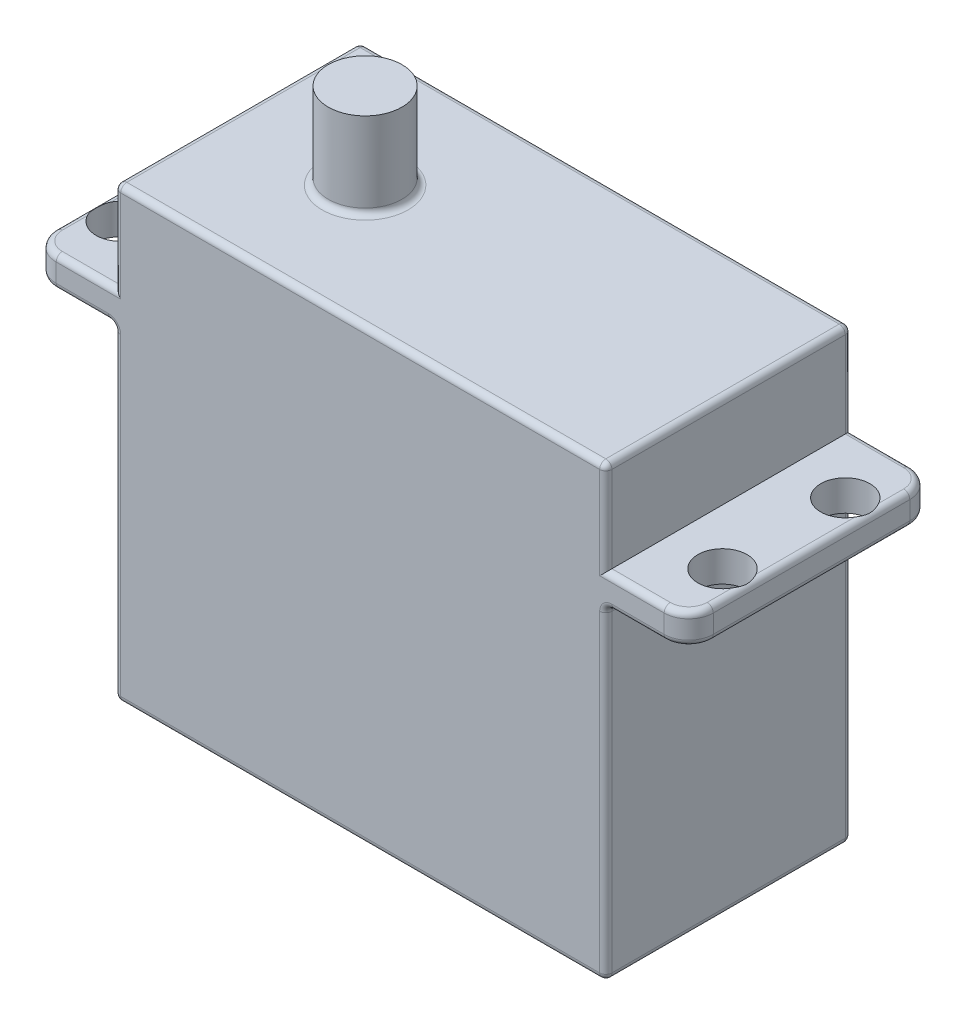
from build123d import *

# Parameters (mm, degrees)
SKETCH_1_W      = 40
SKETCH_1_H      = 20
EXTRUDE_1_DEPTH = 36.5
SKETCH_2_R      = 2.0000000000000027
SKETCH_2_R_2    = 2.000000000000003
SKETCH_2_R_3    = 2.0000000000000036
EXTRUDE_2_DEPTH = 2.5
SKETCH_3_R      = 3.0000000000000013
EXTRUDE_3_DEPTH = 7.000000000000004
FILLET_5_R      = 0.5


with BuildPart() as part:
    # Эскиз1 → Бобышка-Вытянуть1 (new body)
    with BuildSketch(Plane(origin=(0, 0, 0), x_dir=(1, 0, 0), z_dir=(0, 1, 0))):
        with Locations((20, 10)):
            Rectangle(SKETCH_1_W, SKETCH_1_H)
    extrude(amount=EXTRUDE_1_DEPTH)

    # Эскиз2 → Бобышка-Вытянуть2 (add)
    with BuildSketch(Plane(origin=(0, 26.5, 0), x_dir=(-1, 0, 0), z_dir=(0, -1, 0))):
        with BuildLine():
            Line((-44.749999999999986, 20), (4.749999999999984, 20.00000000000001))
            ThreePointArc((4.749999999999984, 20.00000000000001), (6.164213562373094, 19.414213562373106), (6.749999999999999, 17.999999999999996))
            Line((6.749999999999999, 17.999999999999996), (6.749999999999999, 4.031754163448127))
            Line((6.749999999999999, 4.031754163448127), (6.749999999999999, 2.000000000000014))
            ThreePointArc((6.749999999999999, 2.000000000000014), (6.164213562373094, 0.5857864376269049), (4.749999999999985, 0))
            Line((4.749999999999985, 0), (-44.749999999999986, 0))
            ThreePointArc((-44.749999999999986, 0), (-46.16421356237309, 0.5857864376269046), (-46.75, 2.000000000000014))
            Line((-46.75, 2.000000000000014), (-46.75, 17.99999999999999))
            ThreePointArc((-46.75, 17.99999999999999), (-46.16421356237309, 19.4142135623731), (-44.749999999999986, 20))
        make_face()
        with Locations(Location((-44.5, 15, 0), (0, 0, 90))):
            Circle(SKETCH_2_R, mode=Mode.SUBTRACT)
        with Locations(Location((-44.5, 4.999999999999998, 0), (0, 0, 90))):
            Circle(SKETCH_2_R_2, mode=Mode.SUBTRACT)
        with Locations(Location((4.500000000000001, 15, 0), (0, 0, 90))):
            Circle(SKETCH_2_R_3, mode=Mode.SUBTRACT)
        with Locations(Location((4.499999999999997, 4.999999999999998, 0), (0, 0, 90))):
            Circle(SKETCH_2_R_2, mode=Mode.SUBTRACT)
    extrude(amount=-EXTRUDE_2_DEPTH)

    # Эскиз3 → Бобышка-Вытянуть3 (add)
    with BuildSketch(Plane(origin=(0, 36.5, 0), x_dir=(1, 0, 0), z_dir=(0, 1, 0))):
        with Locations(Location((10.4, 10, 0), (0, 0, 90))):
            Circle(SKETCH_3_R)
    extrude(amount=EXTRUDE_3_DEPTH)

    # Скругление5
    # the kernel refuses this fillet: 0.5 mm, written as the material it adds along each edge
    with BuildSketch(Plane(origin=(0, 26.5, -20), x_dir=(0, -1, 0), z_dir=(0, 0, 1))) as fillet_5_piece_1:
        with BuildLine():
            CenterArc((FILLET_5_R, -FILLET_5_R), FILLET_5_R, 90, 90)
            Line((0, -FILLET_5_R), (0, 0))
            Line((0, 0), (FILLET_5_R, 0))
        make_face()
    extrude(amount=20)
    with BuildSketch(Plane(origin=(40, 26.5, 0), x_dir=(1, 0, 0), z_dir=(0, 0, -1))) as fillet_5_piece_2:
        with BuildLine():
            CenterArc((FILLET_5_R, FILLET_5_R), FILLET_5_R, 180, 90)
            Line((0, FILLET_5_R), (0, 0))
            Line((0, 0), (FILLET_5_R, 0))
        make_face()
    extrude(amount=20)
    with BuildSketch(Plane(origin=(10.4, 36.5, -10), x_dir=(0, 0, -1), z_dir=(1, 0, 0))) as fillet_5_piece_3:
        with BuildLine():
            CenterArc((3.0000000000000018 + FILLET_5_R, FILLET_5_R), FILLET_5_R, 180, 90)
            Line((3.0000000000000018, FILLET_5_R), (3.0000000000000018, 0))
            Line((3.0000000000000018, 0), (3.0000000000000018 + FILLET_5_R, 0))
        make_face()
    revolve(axis=Axis((10.4, 36.5, -10), (0, 1, 0)))
    # the kernel refuses this fillet: 0.5 mm, written as the material it takes off along each edge
    with BuildSketch(Plane(origin=(39.5, 36, -0.5), x_dir=(0, 0, 1), z_dir=(1, 0, 0))) as fillet_5_2_piece_1_section:
        Polygon((0, 0), (FILLET_5_R, 0), (FILLET_5_R, -FILLET_5_R), (0, -FILLET_5_R), align=None)
    fillet_5_2_piece_1 = extrude(amount=FILLET_5_R, mode=Mode.PRIVATE)
    fillet_5_2_piece_1 = fillet_5_2_piece_1 - Plane(origin=(39.5, 36, -0.5), x_dir=(0, -0.7071067811865475, -0.7071067811865475), z_dir=(1, 0, 0)) * Sphere(FILLET_5_R, mode=Mode.PRIVATE)
    add(fillet_5_2_piece_1, mode=Mode.SUBTRACT)
    with BuildSketch(Plane(origin=(39.5, 36, -19.5), x_dir=(0, 0, -1), z_dir=(1, 0, 0))) as fillet_5_2_piece_2_section:
        Polygon((0, 0), (FILLET_5_R, 0), (FILLET_5_R, FILLET_5_R), (0, FILLET_5_R), align=None)
    fillet_5_2_piece_2 = extrude(amount=FILLET_5_R, mode=Mode.PRIVATE)
    fillet_5_2_piece_2 = fillet_5_2_piece_2 - Plane(origin=(39.5, 36, -19.5), x_dir=(0, -0.7071067811865475, 0.7071067811865475), z_dir=(1, 0, 0)) * Sphere(FILLET_5_R, mode=Mode.PRIVATE)
    add(fillet_5_2_piece_2, mode=Mode.SUBTRACT)
    with BuildSketch(Plane(origin=(0.5, 36, -19.5), x_dir=(-1, 0, 0), z_dir=(0, 0, -1))) as fillet_5_2_piece_3_section:
        Polygon((0, 0), (FILLET_5_R, 0), (FILLET_5_R, FILLET_5_R), (0, FILLET_5_R), align=None)
    fillet_5_2_piece_3 = extrude(amount=FILLET_5_R, mode=Mode.PRIVATE)
    fillet_5_2_piece_3 = fillet_5_2_piece_3 - Plane(origin=(0.5, 36, -19.5), x_dir=(0.7071067811865475, -0.7071067811865475, 0), z_dir=(0, 0, -1)) * Sphere(FILLET_5_R, mode=Mode.PRIVATE)
    add(fillet_5_2_piece_3, mode=Mode.SUBTRACT)
    with BuildSketch(Plane(origin=(0.5, 36, -0.5), x_dir=(-1, 0, 0), z_dir=(0, 0, 1))) as fillet_5_2_piece_4_section:
        Polygon((0, 0), (FILLET_5_R, 0), (FILLET_5_R, -FILLET_5_R), (0, -FILLET_5_R), align=None)
    fillet_5_2_piece_4 = extrude(amount=FILLET_5_R, mode=Mode.PRIVATE)
    fillet_5_2_piece_4 = fillet_5_2_piece_4 - Plane(origin=(0.5, 36, -0.5), x_dir=(0.7071067811865475, -0.7071067811865475, 0), z_dir=(0, 0, 1)) * Sphere(FILLET_5_R, mode=Mode.PRIVATE)
    add(fillet_5_2_piece_4, mode=Mode.SUBTRACT)
    with BuildSketch(Plane(origin=(40, 36.5, -0.5), x_dir=(-1, 0, 0), z_dir=(0, 0, -1))) as fillet_5_2_piece_5:
        with BuildLine():
            CenterArc((FILLET_5_R, -FILLET_5_R), FILLET_5_R, 90, 90)
            Line((0, -FILLET_5_R), (0, 0))
            Line((0, 0), (FILLET_5_R, 0))
        make_face()
    extrude(amount=19, mode=Mode.SUBTRACT)
    with BuildSketch(Plane(origin=(39.5, 36.5, -20), x_dir=(0, 0, 1), z_dir=(-1, 0, 0))) as fillet_5_2_piece_6:
        with BuildLine():
            CenterArc((FILLET_5_R, -FILLET_5_R), FILLET_5_R, 90, 90)
            Line((0, -FILLET_5_R), (0, 0))
            Line((0, 0), (FILLET_5_R, 0))
        make_face()
    extrude(amount=39, mode=Mode.SUBTRACT)
    with BuildSketch(Plane(origin=(-4.749999999999985, 29, 0), x_dir=(0, -1, 0), z_dir=(1, 0, 0))) as fillet_5_2_piece_7:
        with BuildLine():
            CenterArc((FILLET_5_R, FILLET_5_R), FILLET_5_R, 180, 90)
            Line((0, FILLET_5_R), (0, 0))
            Line((0, 0), (FILLET_5_R, 0))
        make_face()
    extrude(amount=4.749999999999985, mode=Mode.SUBTRACT)
    with BuildSketch(Plane(origin=(40, 29, 0), x_dir=(0, -1, 0), z_dir=(1, 0, 0))) as fillet_5_2_piece_8:
        with BuildLine():
            CenterArc((FILLET_5_R, FILLET_5_R), FILLET_5_R, 180, 90)
            Line((0, FILLET_5_R), (0, 0))
            Line((0, 0), (FILLET_5_R, 0))
        make_face()
    extrude(amount=4.749999999999986, mode=Mode.SUBTRACT)
    with BuildSketch(Plane(origin=(0, 29, -20.00000000000001), x_dir=(-2.2e-16, 0, 1), z_dir=(-1, 0, -2.2e-16)), Plane(origin=(44.749999999999986, 29, -20), x_dir=(-2.2e-16, 0, 1), z_dir=(-1, 0, -2.2e-16))) as fillet_5_2_piece_9:
        with BuildLine():
            CenterArc((FILLET_5_R, -FILLET_5_R), FILLET_5_R, 90, 90)
            Line((0, -FILLET_5_R), (0, 0))
            Line((0, 0), (FILLET_5_R, 0))
        make_face()
    extrude(amount=4.749999999999986, mode=Mode.SUBTRACT)
    with BuildSketch(Plane(origin=(-4.749999999999998, 29, -2.0000000000000004), x_dir=(-1, 0, -6.88e-15), z_dir=(6.88e-15, 0, -1))) as fillet_5_2_piece_10:
        with BuildLine():
            CenterArc((2 - FILLET_5_R, -FILLET_5_R), FILLET_5_R, 0, 89.9999999999998)
            Line((2 - FILLET_5_R, 0), (2, 0))
            Line((2, 0), (2, -FILLET_5_R))
        make_face()
    revolve(axis=Axis((-4.749999999999998, 29, -2.0000000000000004), (0, 1, 0)), revolution_arc=90.00000000000078, mode=Mode.SUBTRACT)
    with BuildSketch(Plane(origin=(44.74999999999999, 29, -2.000000000000005), x_dir=(-3.55e-15, 0, 1), z_dir=(-1, 0, -3.55e-15))) as fillet_5_2_piece_11:
        with BuildLine():
            CenterArc((2.000000000000006 - FILLET_5_R, -FILLET_5_R), FILLET_5_R, 0, 90)
            Line((2.0000000000000067, -FILLET_5_R), (2.000000000000006, 0))
            Line((2.000000000000006, 0), (2.000000000000006 - FILLET_5_R, 0))
        make_face()
    revolve(axis=Axis((44.74999999999999, 29, -2.000000000000005), (0, 1, 0)), revolution_arc=90.00000000000047, mode=Mode.SUBTRACT)
    with BuildSketch(Plane(origin=(46.75, 29, -2.000000000000014), x_dir=(-1, 0, 0), z_dir=(0, 0, -1))) as fillet_5_2_piece_12:
        with BuildLine():
            CenterArc((FILLET_5_R, -FILLET_5_R), FILLET_5_R, 90, 90)
            Line((0, -FILLET_5_R), (0, 0))
            Line((0, 0), (FILLET_5_R, 0))
        make_face()
    extrude(amount=15.999999999999975, mode=Mode.SUBTRACT)
    with BuildSketch(Plane(origin=(44.75, 29, -18.000000000000004), x_dir=(1, 0, 7.11e-15), z_dir=(-7.11e-15, 0, 1))) as fillet_5_2_piece_13:
        with BuildLine():
            CenterArc((2 - FILLET_5_R, -FILLET_5_R), FILLET_5_R, 0, 90)
            Line((2, -FILLET_5_R), (2, 0))
            Line((2, 0), (2 - FILLET_5_R, 0))
        make_face()
    revolve(axis=Axis((44.75, 29, -18.000000000000004), (0, 1, 0)), revolution_arc=90.00000000000081, mode=Mode.SUBTRACT)
    with BuildSketch(Plane(origin=(-4.75, 29, -18.000000000000014), x_dir=(7.99e-15, 0, -1), z_dir=(1, 0, 7.99e-15))) as fillet_5_2_piece_14:
        with BuildLine():
            CenterArc((1.9999999999999964 - FILLET_5_R, -FILLET_5_R), FILLET_5_R, 0, 90)
            Line((1.9999999999999964, -FILLET_5_R), (1.9999999999999964, 0))
            Line((1.9999999999999964, 0), (1.9999999999999964 - FILLET_5_R, 0))
        make_face()
    revolve(axis=Axis((-4.75, 29, -18.000000000000014), (0, 1, 0)), revolution_arc=90.00000000000097, mode=Mode.SUBTRACT)
    with BuildSketch(Plane(origin=(-6.749999999999998, 29, -2.000000000000014), x_dir=(1, 0, 0), z_dir=(0, 0, -1))) as fillet_5_2_piece_15:
        with BuildLine():
            CenterArc((FILLET_5_R, FILLET_5_R), FILLET_5_R, 180, 90)
            Line((-1.78e-15, FILLET_5_R), (0, 0))
            Line((0, 0), (FILLET_5_R, 0))
        make_face()
    extrude(amount=15.999999999999982, mode=Mode.SUBTRACT)
    with BuildSketch(Plane(origin=(0, 36.5, -19.5), x_dir=(0, -1, 0), z_dir=(0, 0, 1))) as fillet_5_2_piece_16:
        with BuildLine():
            CenterArc((FILLET_5_R, FILLET_5_R), FILLET_5_R, 180, 90)
            Line((0, FILLET_5_R), (0, 0))
            Line((0, 0), (FILLET_5_R, 0))
        make_face()
    extrude(amount=19, mode=Mode.SUBTRACT)
    with BuildSketch(Plane(origin=(41.25, 0, -20), x_dir=(0, 0, 1), z_dir=(-1, 0, 0))) as fillet_5_2_piece_17:
        with BuildLine():
            CenterArc((FILLET_5_R, FILLET_5_R), FILLET_5_R, 180, 90)
            Line((0, FILLET_5_R), (0, 0))
            Line((0, 0), (FILLET_5_R, 0))
        make_face()
    extrude(amount=42.5, mode=Mode.SUBTRACT)
    with BuildSketch(Plane(origin=(40, 0, 1.25), x_dir=(-1, 0, 0), z_dir=(0, 0, -1))) as fillet_5_2_piece_18:
        with BuildLine():
            CenterArc((FILLET_5_R, FILLET_5_R), FILLET_5_R, 180, 90)
            Line((0, FILLET_5_R), (0, 0))
            Line((0, 0), (FILLET_5_R, 0))
        make_face()
    extrude(amount=22.5, mode=Mode.SUBTRACT)
    with BuildSketch(Plane(origin=(-1.25, 0, 0), x_dir=(0, 1, 0), z_dir=(1, 0, 0))) as fillet_5_2_piece_19:
        with BuildLine():
            CenterArc((FILLET_5_R, -FILLET_5_R), FILLET_5_R, 90, 90)
            Line((-6e-17, -FILLET_5_R), (0, 0))
            Line((0, 0), (FILLET_5_R, 0))
        make_face()
    extrude(amount=42.5, mode=Mode.SUBTRACT)
    with BuildSketch(Plane(origin=(0, 0, -21.25), x_dir=(1, 0, 0), z_dir=(0, 0, 1))) as fillet_5_2_piece_20:
        with BuildLine():
            CenterArc((FILLET_5_R, FILLET_5_R), FILLET_5_R, 180, 90)
            Line((0, FILLET_5_R), (0, 0))
            Line((0, 0), (FILLET_5_R, 0))
        make_face()
    extrude(amount=22.5, mode=Mode.SUBTRACT)
    with BuildSketch(Plane(origin=(0, 29, -20), x_dir=(0, 0, 1), z_dir=(0, 1, 0))) as fillet_5_2_piece_21:
        with BuildLine():
            CenterArc((FILLET_5_R, FILLET_5_R), FILLET_5_R, 180, 90)
            Line((0, FILLET_5_R), (0, 0))
            Line((0, 0), (FILLET_5_R, 0))
        make_face()
    extrude(amount=7, mode=Mode.SUBTRACT)
    with BuildSketch(Plane(origin=(40, 29, -20), x_dir=(0, 0, 1), z_dir=(0, 1, 0))) as fillet_5_2_piece_22:
        with BuildLine():
            CenterArc((FILLET_5_R, -FILLET_5_R), FILLET_5_R, 90, 90)
            Line((0, -FILLET_5_R), (0, 0))
            Line((0, 0), (FILLET_5_R, 0))
        make_face()
    extrude(amount=7, mode=Mode.SUBTRACT)
    with BuildSketch(Plane(origin=(40, 29, 0), x_dir=(-1, 0, 0), z_dir=(0, 1, 0))) as fillet_5_2_piece_23:
        with BuildLine():
            CenterArc((FILLET_5_R, -FILLET_5_R), FILLET_5_R, 90, 90)
            Line((0, -FILLET_5_R), (0, 0))
            Line((0, 0), (FILLET_5_R, 0))
        make_face()
    extrude(amount=7, mode=Mode.SUBTRACT)
    with BuildSketch(Plane(origin=(0, 29, 0), x_dir=(1, 0, 0), z_dir=(0, 1, 0))) as fillet_5_2_piece_24:
        with BuildLine():
            CenterArc((FILLET_5_R, FILLET_5_R), FILLET_5_R, 180, 90)
            Line((-6e-17, FILLET_5_R), (0, 0))
            Line((0, 0), (FILLET_5_R, 0))
        make_face()
    extrude(amount=7, mode=Mode.SUBTRACT)
    with BuildSketch(Plane(origin=(0.5, 36.5, 0), x_dir=(0, -1, 0), z_dir=(1, 0, 0))) as fillet_5_2_piece_25:
        with BuildLine():
            CenterArc((FILLET_5_R, FILLET_5_R), FILLET_5_R, 180, 90)
            Line((0, FILLET_5_R), (0, 0))
            Line((0, 0), (FILLET_5_R, 0))
        make_face()
    extrude(amount=39, mode=Mode.SUBTRACT)
    with BuildSketch(Plane(origin=(-4.749999999999985, 29, 0), x_dir=(0, -1, 0), z_dir=(1, 0, 0))) as fillet_5_2_piece_26a_section:
        with BuildLine():
            CenterArc((FILLET_5_R, FILLET_5_R), FILLET_5_R, 180, 90)
            Line((0, FILLET_5_R), (0, 0))
            Line((0, 0), (FILLET_5_R, 0))
        make_face()
    fillet_5_2_piece_26a = extrude(amount=5.999999999999985, mode=Mode.PRIVATE)
    fillet_5_2_piece_26a = split(fillet_5_2_piece_26a, bisect_by=Plane(origin=(0, 28.88680244286659, -0.1131975571334145), z_dir=(1, 0, 0)), keep=Keep.TOP, mode=Mode.PRIVATE)
    with BuildSketch(Plane(origin=(0, 27.75, 0), x_dir=(1, 0, 0), z_dir=(0, 1, 0))) as fillet_5_2_piece_26b_section:
        with BuildLine():
            CenterArc((FILLET_5_R, FILLET_5_R), FILLET_5_R, 180, 90)
            Line((-6e-17, FILLET_5_R), (0, 0))
            Line((0, 0), (FILLET_5_R, 0))
        make_face()
    fillet_5_2_piece_26b = extrude(amount=8.25, mode=Mode.PRIVATE)
    fillet_5_2_piece_26b = split(fillet_5_2_piece_26b, bisect_by=Plane(origin=(0.11319755713341095, 29, -0.11319755713341273), z_dir=(0, -1, 0)), keep=Keep.TOP, mode=Mode.PRIVATE)
    fillet_5_2_piece_26 = fillet_5_2_piece_26a & fillet_5_2_piece_26b
    add(fillet_5_2_piece_26, mode=Mode.SUBTRACT)
    with BuildSketch(Plane(origin=(40, 27.75, 0), x_dir=(-1, 0, 0), z_dir=(0, 1, 0))) as fillet_5_2_piece_27a_section:
        with BuildLine():
            CenterArc((FILLET_5_R, -FILLET_5_R), FILLET_5_R, 90, 90)
            Line((0, -FILLET_5_R), (0, 0))
            Line((0, 0), (FILLET_5_R, 0))
        make_face()
    fillet_5_2_piece_27a = extrude(amount=8.25, mode=Mode.PRIVATE)
    fillet_5_2_piece_27a = split(fillet_5_2_piece_27a, bisect_by=Plane(origin=(39.886802442866596, 29, -0.11319755713341095), z_dir=(0, -1, 0)), keep=Keep.TOP, mode=Mode.PRIVATE)
    with BuildSketch(Plane(origin=(38.75, 29, 0), x_dir=(0, -1, 0), z_dir=(1, 0, 0))) as fillet_5_2_piece_27b_section:
        with BuildLine():
            CenterArc((FILLET_5_R, FILLET_5_R), FILLET_5_R, 180, 90)
            Line((0, FILLET_5_R), (0, 0))
            Line((0, 0), (FILLET_5_R, 0))
        make_face()
    fillet_5_2_piece_27b = extrude(amount=5.999999999999986, mode=Mode.PRIVATE)
    fillet_5_2_piece_27b = split(fillet_5_2_piece_27b, bisect_by=Plane(origin=(40, 28.886802442866593, -0.11319755713341453), z_dir=(-1, 0, 0)), keep=Keep.TOP, mode=Mode.PRIVATE)
    fillet_5_2_piece_27 = fillet_5_2_piece_27a & fillet_5_2_piece_27b
    add(fillet_5_2_piece_27, mode=Mode.SUBTRACT)
    with BuildSketch(Plane(origin=(1.25, 29, -20), x_dir=(-2.2e-16, 0, 1), z_dir=(-1, 0, -2.2e-16))) as fillet_5_2_piece_28a_section:
        with BuildLine():
            CenterArc((FILLET_5_R, -FILLET_5_R), FILLET_5_R, 90, 90)
            Line((0, -FILLET_5_R), (0, 0))
            Line((0, 0), (FILLET_5_R, 0))
        make_face()
    fillet_5_2_piece_28a = extrude(amount=5.999999999999986, mode=Mode.PRIVATE)
    fillet_5_2_piece_28a = split(fillet_5_2_piece_28a, bisect_by=Plane(origin=(0, 28.886802442866593, -19.886802442866593), z_dir=(1, 0, 0)), keep=Keep.TOP, mode=Mode.PRIVATE)
    with BuildSketch(Plane(origin=(0, 27.75, -20), x_dir=(0, 0, 1), z_dir=(0, 1, 0))) as fillet_5_2_piece_28b_section:
        with BuildLine():
            CenterArc((FILLET_5_R, FILLET_5_R), FILLET_5_R, 180, 90)
            Line((0, FILLET_5_R), (0, 0))
            Line((0, 0), (FILLET_5_R, 0))
        make_face()
    fillet_5_2_piece_28b = extrude(amount=8.25, mode=Mode.PRIVATE)
    fillet_5_2_piece_28b = split(fillet_5_2_piece_28b, bisect_by=Plane(origin=(0.1131975571334145, 29, -19.88680244286659), z_dir=(0, -1, 0)), keep=Keep.TOP, mode=Mode.PRIVATE)
    fillet_5_2_piece_28 = fillet_5_2_piece_28a & fillet_5_2_piece_28b
    add(fillet_5_2_piece_28, mode=Mode.SUBTRACT)
    with BuildSketch(Plane(origin=(40, 27.75, -20), x_dir=(0, 0, 1), z_dir=(0, 1, 0))) as fillet_5_2_piece_29a_section:
        with BuildLine():
            CenterArc((FILLET_5_R, -FILLET_5_R), FILLET_5_R, 90, 90)
            Line((0, -FILLET_5_R), (0, 0))
            Line((0, 0), (FILLET_5_R, 0))
        make_face()
    fillet_5_2_piece_29a = extrude(amount=8.25, mode=Mode.PRIVATE)
    fillet_5_2_piece_29a = split(fillet_5_2_piece_29a, bisect_by=Plane(origin=(39.886802442866575, 29, -19.886802442866593), z_dir=(0, -1, 0)), keep=Keep.TOP, mode=Mode.PRIVATE)
    with BuildSketch(Plane(origin=(44.749999999999986, 29, -20), x_dir=(-2.2e-16, 0, 1), z_dir=(-1, 0, -2.2e-16))) as fillet_5_2_piece_29b_section:
        with BuildLine():
            CenterArc((FILLET_5_R, -FILLET_5_R), FILLET_5_R, 90, 90)
            Line((0, -FILLET_5_R), (0, 0))
            Line((0, 0), (FILLET_5_R, 0))
        make_face()
    fillet_5_2_piece_29b = extrude(amount=5.999999999999986, mode=Mode.PRIVATE)
    fillet_5_2_piece_29b = split(fillet_5_2_piece_29b, bisect_by=Plane(origin=(40, 28.88680244286659, -19.88680244286659), z_dir=(-1, 0, 0)), keep=Keep.TOP, mode=Mode.PRIVATE)
    fillet_5_2_piece_29 = fillet_5_2_piece_29a & fillet_5_2_piece_29b
    add(fillet_5_2_piece_29, mode=Mode.SUBTRACT)
    # the kernel refuses this fillet: 0.5 mm, written as the material it takes off along each edge
    with BuildSketch(Plane(origin=(0.5, 0.5, -0.5), x_dir=(-1, 0, 0), z_dir=(0, 0, 1))) as fillet_5_3_piece_1_section:
        Polygon((0, 0), (FILLET_5_R, 0), (FILLET_5_R, FILLET_5_R), (0, FILLET_5_R), align=None)
    fillet_5_3_piece_1 = extrude(amount=FILLET_5_R, mode=Mode.PRIVATE)
    fillet_5_3_piece_1 = fillet_5_3_piece_1 - Plane(origin=(0.5, 0.5, -0.5), x_dir=(0.7071067811865475, 0.7071067811865475, 0), z_dir=(0, 0, 1)) * Sphere(FILLET_5_R, mode=Mode.PRIVATE)
    add(fillet_5_3_piece_1, mode=Mode.SUBTRACT)
    with BuildSketch(Plane(origin=(39.5, 0.5, -0.5), x_dir=(1, 0, 0), z_dir=(0, 0, 1))) as fillet_5_3_piece_2_section:
        Polygon((0, 0), (FILLET_5_R, 0), (FILLET_5_R, -FILLET_5_R), (0, -FILLET_5_R), align=None)
    fillet_5_3_piece_2 = extrude(amount=FILLET_5_R, mode=Mode.PRIVATE)
    fillet_5_3_piece_2 = fillet_5_3_piece_2 - Plane(origin=(39.5, 0.5, -0.5), x_dir=(-0.7071067811865475, 0.7071067811865475, 0), z_dir=(0, 0, 1)) * Sphere(FILLET_5_R, mode=Mode.PRIVATE)
    add(fillet_5_3_piece_2, mode=Mode.SUBTRACT)
    with BuildSketch(Plane(origin=(39.5, 0.5, -19.5), x_dir=(0, 0, -1), z_dir=(1, 0, 0))) as fillet_5_3_piece_3_section:
        Polygon((0, 0), (FILLET_5_R, 0), (FILLET_5_R, -FILLET_5_R), (0, -FILLET_5_R), align=None)
    fillet_5_3_piece_3 = extrude(amount=FILLET_5_R, mode=Mode.PRIVATE)
    fillet_5_3_piece_3 = fillet_5_3_piece_3 - Plane(origin=(39.5, 0.5, -19.5), x_dir=(0, 0.7071067811865475, 0.7071067811865475), z_dir=(1, 0, 0)) * Sphere(FILLET_5_R, mode=Mode.PRIVATE)
    add(fillet_5_3_piece_3, mode=Mode.SUBTRACT)
    with BuildSketch(Plane(origin=(0.5, 0.5, -19.5), x_dir=(-1, 0, 0), z_dir=(0, 0, -1))) as fillet_5_3_piece_4_section:
        Polygon((0, 0), (FILLET_5_R, 0), (FILLET_5_R, -FILLET_5_R), (0, -FILLET_5_R), align=None)
    fillet_5_3_piece_4 = extrude(amount=FILLET_5_R, mode=Mode.PRIVATE)
    fillet_5_3_piece_4 = fillet_5_3_piece_4 - Plane(origin=(0.5, 0.5, -19.5), x_dir=(0.7071067811865475, 0.7071067811865475, 0), z_dir=(0, 0, -1)) * Sphere(FILLET_5_R, mode=Mode.PRIVATE)
    add(fillet_5_3_piece_4, mode=Mode.SUBTRACT)
    with BuildSketch(Plane(origin=(0, 0.49999999999999994, -20), x_dir=(1, 0, 0), z_dir=(0, 1, 0))) as fillet_5_3_piece_5:
        with BuildLine():
            CenterArc((FILLET_5_R, -FILLET_5_R), FILLET_5_R, 90, 90)
            Line((0, -FILLET_5_R), (0, 0))
            Line((0, 0), (FILLET_5_R, 0))
        make_face()
    extrude(amount=25.5, mode=Mode.SUBTRACT)
    with BuildSketch(Plane(origin=(40, 0.49999999999999994, -20), x_dir=(0, 0, 1), z_dir=(0, 1, 0))) as fillet_5_3_piece_6:
        with BuildLine():
            CenterArc((FILLET_5_R, -FILLET_5_R), FILLET_5_R, 90, 90)
            Line((0, -FILLET_5_R), (0, 0))
            Line((0, 0), (FILLET_5_R, 0))
        make_face()
    extrude(amount=25.5, mode=Mode.SUBTRACT)
    with BuildSketch(Plane(origin=(40, 0.49999999999999994, 0), x_dir=(-1, 0, 0), z_dir=(0, 1, 0))) as fillet_5_3_piece_7:
        with BuildLine():
            CenterArc((FILLET_5_R, -FILLET_5_R), FILLET_5_R, 90, 90)
            Line((0, -FILLET_5_R), (0, 0))
            Line((0, 0), (FILLET_5_R, 0))
        make_face()
    extrude(amount=25.5, mode=Mode.SUBTRACT)
    with BuildSketch(Plane(origin=(0, 0.49999999999999994, 0), x_dir=(1, 0, 0), z_dir=(0, 1, 0))) as fillet_5_3_piece_8:
        with BuildLine():
            CenterArc((FILLET_5_R, FILLET_5_R), FILLET_5_R, 180, 90)
            Line((-6e-17, FILLET_5_R), (0, 0))
            Line((0, 0), (FILLET_5_R, 0))
        make_face()
    extrude(amount=25.5, mode=Mode.SUBTRACT)
    with BuildSketch(Plane(origin=(-4.749999999999985, 26.5, 0), x_dir=(0, 1, 0), z_dir=(1, 0, 0))) as fillet_5_3_piece_9:
        with BuildLine():
            CenterArc((FILLET_5_R, -FILLET_5_R), FILLET_5_R, 90, 90)
            Line((0, -FILLET_5_R), (0, 0))
            Line((0, 0), (FILLET_5_R, 0))
        make_face()
    extrude(amount=4.249999999999985, mode=Mode.SUBTRACT)
    with BuildSketch(Plane(origin=(-4.749999999999998, 26.5, -2.0000000000000004), x_dir=(-1, 0, -6.88e-15), z_dir=(6.88e-15, 0, -1))) as fillet_5_3_piece_10:
        with BuildLine():
            CenterArc((2 - FILLET_5_R, FILLET_5_R), FILLET_5_R, 270.0000000000002, 89.99999999999977)
            Line((2 - FILLET_5_R, 0), (2, 0))
            Line((2, 0), (2, FILLET_5_R))
        make_face()
    revolve(axis=Axis((-4.749999999999998, 26.5, -2.0000000000000004), (0, 1, 0)), revolution_arc=90.00000000000078, mode=Mode.SUBTRACT)
    with BuildSketch(Plane(origin=(-6.749999999999998, 26.5, -17.999999999999996), x_dir=(-1.78e-15, 1, 0), z_dir=(0, 0, 1))) as fillet_5_3_piece_11:
        with BuildLine():
            CenterArc((FILLET_5_R, -FILLET_5_R), FILLET_5_R, 89.9999999999999, 89.9999999999999)
            Line((-8.9e-16, -FILLET_5_R), (0, 0))
            Line((0, 0), (FILLET_5_R, 0))
        make_face()
    extrude(amount=15.999999999999982, mode=Mode.SUBTRACT)
    with BuildSketch(Plane(origin=(-4.75, 26.5, -18.000000000000014), x_dir=(7.99e-15, 0, -1), z_dir=(1, 0, 7.99e-15))) as fillet_5_3_piece_12:
        with BuildLine():
            CenterArc((1.9999999999999964 - FILLET_5_R, FILLET_5_R), FILLET_5_R, 270, 90)
            Line((1.9999999999999964 - FILLET_5_R, 0), (1.9999999999999964, 0))
            Line((1.9999999999999964, 0), (1.9999999999999964, FILLET_5_R))
        make_face()
    revolve(axis=Axis((-4.75, 26.5, -18.000000000000014), (0, 1, 0)), revolution_arc=90.00000000000097, mode=Mode.SUBTRACT)
    with BuildSketch(Plane(origin=(-0.5, 26.5, -20.00000000000001), x_dir=(0, 1, 2.132e-14), z_dir=(-1, 0, -2.2e-16))) as fillet_5_3_piece_13:
        with BuildLine():
            CenterArc((FILLET_5_R, -FILLET_5_R), FILLET_5_R, 90.00000000000122, 89.99999999999878)
            Line((1.066e-14, -FILLET_5_R), (0, 0))
            Line((0, 0), (FILLET_5_R, 0))
        make_face()
    extrude(amount=4.249999999999986, mode=Mode.SUBTRACT)
    with BuildSketch(Plane(origin=(44.749999999999986, 26.5, -20), x_dir=(0, 1, 0), z_dir=(-1, 0, -2.2e-16))) as fillet_5_3_piece_14:
        with BuildLine():
            CenterArc((FILLET_5_R, -FILLET_5_R), FILLET_5_R, 90, 90)
            Line((0, -FILLET_5_R), (0, 0))
            Line((0, 0), (FILLET_5_R, 0))
        make_face()
    extrude(amount=4.249999999999986, mode=Mode.SUBTRACT)
    with BuildSketch(Plane(origin=(44.75, 26.5, -18.000000000000004), x_dir=(1, 0, 7.11e-15), z_dir=(-7.11e-15, 0, 1))) as fillet_5_3_piece_15:
        with BuildLine():
            CenterArc((2 - FILLET_5_R, FILLET_5_R), FILLET_5_R, 270, 90)
            Line((2 - FILLET_5_R, 0), (2, 0))
            Line((2, 0), (2, FILLET_5_R))
        make_face()
    revolve(axis=Axis((44.75, 26.5, -18.000000000000004), (0, 1, 0)), revolution_arc=90.00000000000081, mode=Mode.SUBTRACT)
    with BuildSketch(Plane(origin=(46.75, 26.5, -2.000000000000014), x_dir=(0, 1, 0), z_dir=(0, 0, -1))) as fillet_5_3_piece_16:
        with BuildLine():
            CenterArc((FILLET_5_R, -FILLET_5_R), FILLET_5_R, 90, 90)
            Line((0, -FILLET_5_R), (0, 0))
            Line((0, 0), (FILLET_5_R, 0))
        make_face()
    extrude(amount=15.999999999999975, mode=Mode.SUBTRACT)
    with BuildSketch(Plane(origin=(44.74999999999999, 26.5, -2.000000000000005), x_dir=(-3.55e-15, 0, 1), z_dir=(-1, 0, -3.55e-15))) as fillet_5_3_piece_17:
        with BuildLine():
            CenterArc((2.000000000000006 - FILLET_5_R, FILLET_5_R), FILLET_5_R, 270, 90)
            Line((2.0000000000000067, FILLET_5_R), (2.000000000000006, 0))
            Line((2.000000000000006, 0), (2.000000000000006 - FILLET_5_R, 0))
        make_face()
    revolve(axis=Axis((44.74999999999999, 26.5, -2.000000000000005), (0, 1, 0)), revolution_arc=90.00000000000047, mode=Mode.SUBTRACT)
    with BuildSketch(Plane(origin=(40.5, 26.5, 0), x_dir=(0, 1, 0), z_dir=(1, 0, 0))) as fillet_5_3_piece_18:
        with BuildLine():
            CenterArc((FILLET_5_R, -FILLET_5_R), FILLET_5_R, 90, 90)
            Line((0, -FILLET_5_R), (0, 0))
            Line((0, 0), (FILLET_5_R, 0))
        make_face()
    extrude(amount=4.249999999999986, mode=Mode.SUBTRACT)
    with BuildSketch(Plane(origin=(40.5, 26, 0), x_dir=(0, 1, 0), z_dir=(1, 0, 0))) as fillet_5_3_piece_19:
        with BuildLine():
            CenterArc((0.5 + FILLET_5_R, -FILLET_5_R), FILLET_5_R, 90, 90)
            Line((0.5, -FILLET_5_R), (0.5, 0))
            Line((0.5, 0), (0.5 + FILLET_5_R, 0))
        make_face()
    revolve(axis=Axis((40.5, 26, 0), (0, 0, 1)), revolution_arc=90, mode=Mode.SUBTRACT)
    with BuildSketch(Plane(origin=(40.5, 26, -20), x_dir=(0, 1, 0), z_dir=(1, 0, 0))) as fillet_5_3_piece_20:
        with BuildLine():
            CenterArc((0.5 + FILLET_5_R, FILLET_5_R), FILLET_5_R, 180, 90)
            Line((0.5, FILLET_5_R), (0.5, 0))
            Line((0.5, 0), (0.5 + FILLET_5_R, 0))
        make_face()
    revolve(axis=Axis((40.5, 26, -20), (0, 0, 1)), revolution_arc=90, mode=Mode.SUBTRACT)
    with BuildSketch(Plane(origin=(-0.5, 26, -20), x_dir=(1, 0, 0), z_dir=(0, -1, 0))) as fillet_5_3_piece_21:
        with BuildLine():
            CenterArc((0.5 + FILLET_5_R, FILLET_5_R), FILLET_5_R, 180, 90)
            Line((0.5, FILLET_5_R), (0.5, 0))
            Line((0.5, 0), (0.5 + FILLET_5_R, 0))
        make_face()
    revolve(axis=Axis((-0.5, 26, -20), (0, 0, 1)), revolution_arc=90, mode=Mode.SUBTRACT)
    with BuildSketch(Plane(origin=(-0.5, 26, 0), x_dir=(1, 0, 0), z_dir=(0, -1, 0))) as fillet_5_3_piece_22:
        with BuildLine():
            CenterArc((0.5 + FILLET_5_R, -FILLET_5_R), FILLET_5_R, 90, 90)
            Line((0.49999999999999994, -FILLET_5_R), (0.5, 0))
            Line((0.5, 0), (0.5 + FILLET_5_R, 0))
        make_face()
    revolve(axis=Axis((-0.5, 26, 0), (0, 0, 1)), revolution_arc=90, mode=Mode.SUBTRACT)


solid = part.part
